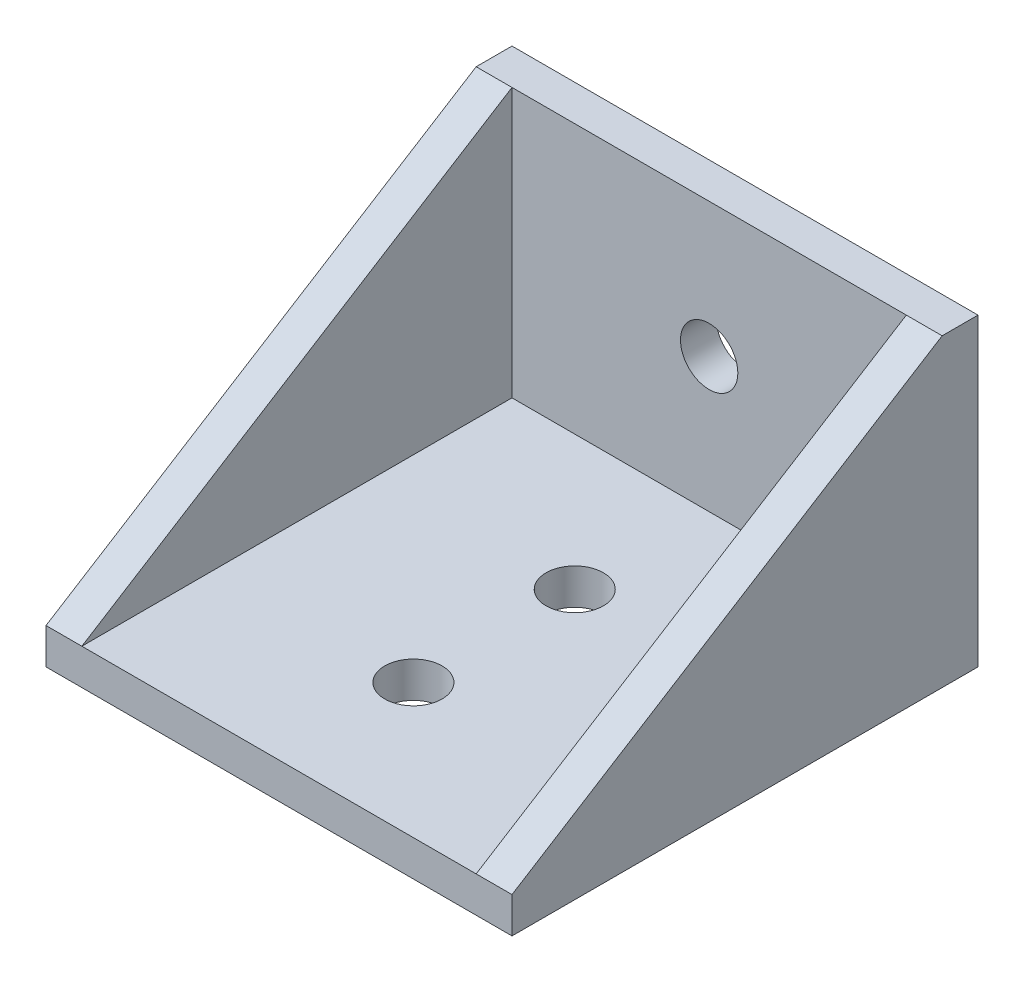
from build123d import *

# Parameters (mm, degrees)
SKETCH_1_W          = 26
SKETCH_1_H          = 26
EXTRUDE_1_DEPTH     = 17
CUT_EXTRUDE_1_DEPTH = 34.674916481
SHELL_START         = -11
SHELL_2_DEPTH       = 22
SKETCH_3_R          = 1.6
CUT_EXTRUDE_2_DEPTH = 24.727621035
SKETCH_4_R          = 1.6
CUT_EXTRUDE_3_DEPTH = 33.155870382


# Read off the part's stored shape, not the designer's step: ｼｪﾙ2
with BuildPart() as part:
    # ｽｹｯﾁ1 → ﾎﾞｽ - 押し出し1 (new body)
    with BuildSketch(Plane(origin=(0, 0, 0), x_dir=(1, 0, 0), z_dir=(0, 1, 0))):
        Rectangle(SKETCH_1_W, SKETCH_1_H)
    extrude(amount=EXTRUDE_1_DEPTH)

    # ｽｹｯﾁ2 → ｶｯﾄ - 押し出し1 (cut, through all)
    with BuildSketch(Plane(origin=(13, 0, 0), x_dir=(0, 0, -1), z_dir=(1, 0, 0))):
        Polygon((11, 17), (-13, 2), (-13, 17), align=None)
    extrude(amount=-CUT_EXTRUDE_1_DEPTH, mode=Mode.SUBTRACT)

    # ｼｪﾙ2 outline → ｼｪﾙ2 (cut)
    with BuildSketch(Plane.YZ.offset(SHELL_START)):
        Polygon((2, -11), (17, -11), (2, 13), align=None)
    extrude(amount=SHELL_2_DEPTH, mode=Mode.SUBTRACT)

    # ｽｹｯﾁ3 → ｶｯﾄ - 押し出し2 (cut, through all)
    with BuildSketch(Plane(origin=(0, 2, 0), x_dir=(1, 0, 0), z_dir=(0, 1, 0))):
        with Locations(Location((0, 3.5, 0), (0, 0, 270))):
            Circle(SKETCH_3_R)
        with Locations(Location((0, -5.5, 0), (0, 0, 270))):
            Circle(SKETCH_3_R)
    extrude(amount=-CUT_EXTRUDE_2_DEPTH, mode=Mode.SUBTRACT)

    # ｽｹｯﾁ4 → ｶｯﾄ - 押し出し3 (cut, through all)
    with BuildSketch(Plane.XY.offset(-11)):
        with Locations((0, 9.5)):
            Circle(SKETCH_4_R)
    extrude(amount=-CUT_EXTRUDE_3_DEPTH, mode=Mode.SUBTRACT)


solid = part.part
